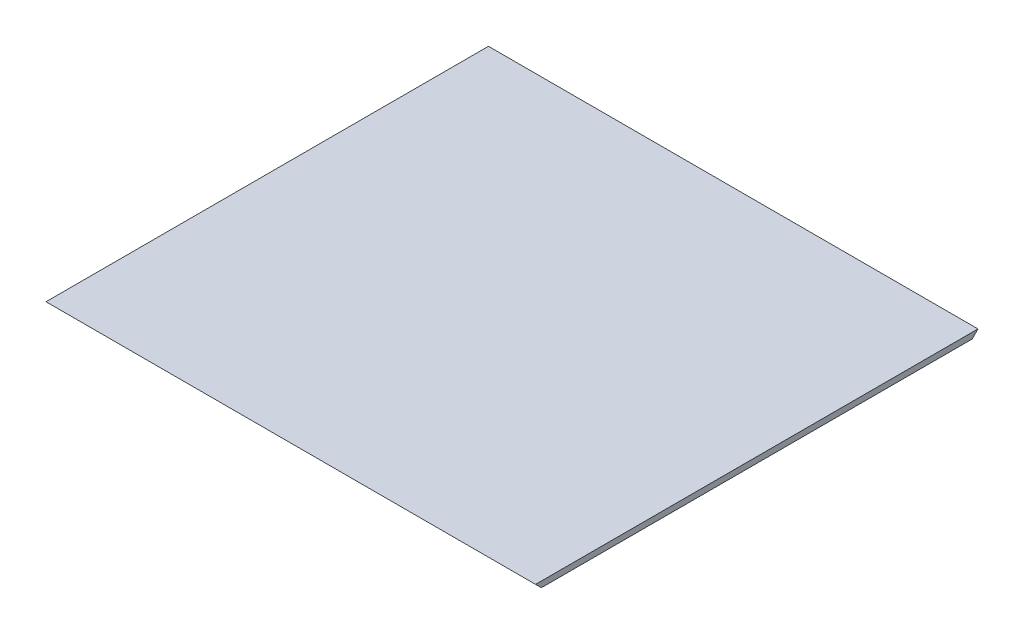
from build123d import *

# Parameters (mm, degrees)
SKETCH1_W           = 266.7
SKETCH1_H           = 241.046
BOSS_EXTRUDE1_DEPTH = 1.5875
CUT_EXTRUDE2_DEPTH  = 293.672519525


with BuildPart() as part:
    # Sketch1 → Boss-Extrude1 (new, symmetric)
    with BuildSketch(Plane(origin=(0, 0, 0), x_dir=(1, 0, 0), z_dir=(0, 1, 0))):
        Rectangle(SKETCH1_W, SKETCH1_H)
    extrude(amount=BOSS_EXTRUDE1_DEPTH, both=True)

    # Sketch3 → Cut-Extrude2 (cut, through all)
    with BuildSketch(Plane.ZY.offset(133.35)):
        Polygon((120.523, 1.5875), (117.316753604, -1.5875), (119.180767797, -3.469858674), (122.387014193, -0.294858674), align=None)
        Polygon((-120.523, 1.5875), (-115.936493069, -2.999006931), (-119.219444539, -6.281958402), (-123.80595147, -1.69545147), align=None)
    extrude(amount=-CUT_EXTRUDE2_DEPTH, mode=Mode.SUBTRACT)


solid = part.part
